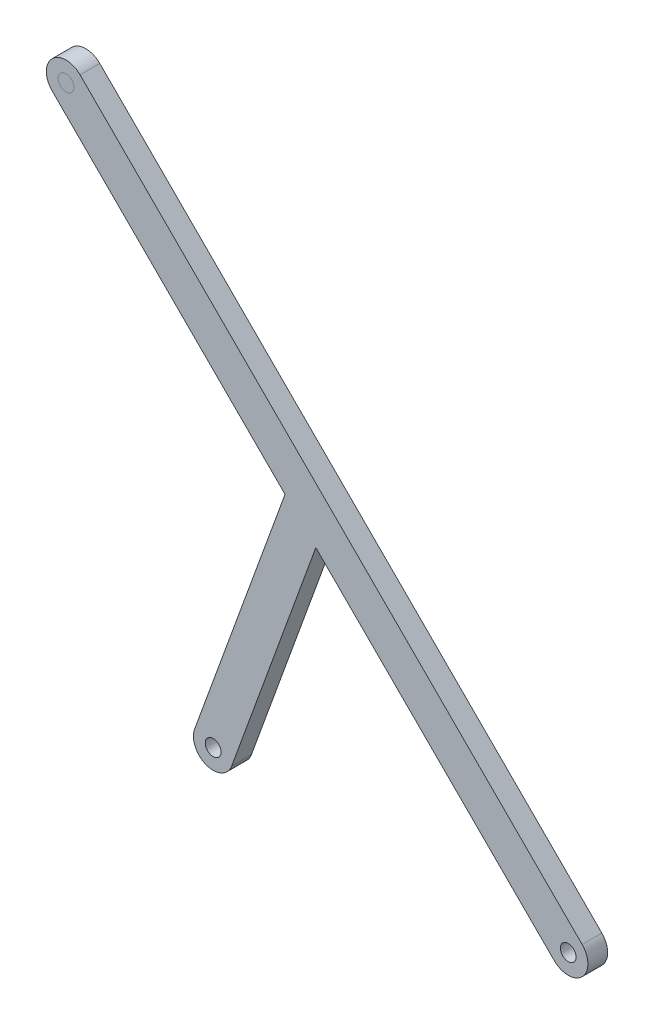
from build123d import *

# Parameters (mm, degrees)
BOSS_EXTRUDE1_DEPTH = 10
SKETCH2_R           = 4
CUT_EXTRUDE1_DEPTH  = 10


# Read off the part's stored shape, not the designer's step: Boss-Extrude1
with BuildPart() as part:
    # Boss-Extrude1 outline → Boss-Extrude1 (new body)
    with BuildSketch(Plane.XY):
        with BuildLine():
            ThreePointArc((-7.071067812, -7.071067812), (7.071067812, -7.071067812), (7.071067812, 7.071067812))
            Line((7.071067812, 7.071067812), (-247.487373415, 261.629509039))
            ThreePointArc((-247.487373415, 261.629509039), (-261.629509039, 261.629509039), (-261.629509039, 247.487373415))
            Line((-261.629509039, 247.487373415), (-143.543524061, 129.401388437))
            Line((-143.543524061, 129.401388437), (-189.396926208, 3.420201433))
            ThreePointArc((-189.396926208, 3.420201433), (-183.420201433, -9.396926208), (-170.603073792, -3.420201433))
            Line((-170.603073792, -3.420201433), (-127.939403887, 113.797268263))
            Line((-127.939403887, 113.797268263), (-7.071067812, -7.071067812))
        make_face()
    extrude(amount=BOSS_EXTRUDE1_DEPTH)

    # Sketch2 → Cut-Extrude1 (cut)
    with BuildSketch(Plane.XY.offset(10)):
        Circle(SKETCH2_R)
        with Locations((-180, 0)):
            Circle(SKETCH2_R)
    extrude(amount=-CUT_EXTRUDE1_DEPTH, mode=Mode.SUBTRACT)


solid = part.part
